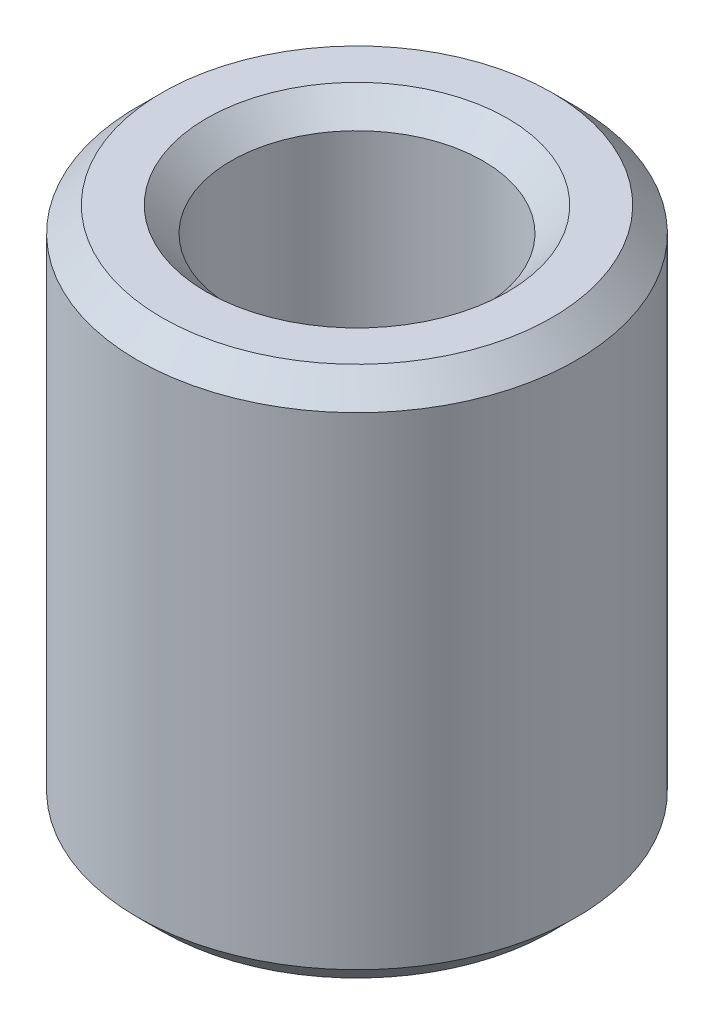
from build123d import *

# Parameters (mm, degrees)
SKETCH1_R           = 20
BOSS_EXTRUDE1_DEPTH = 48.429823894
SKETCH2_R           = 11.471340663
CUT_EXTRUDE1_DEPTH  = 57.084292297
CHAMFER1_SIZE       = 2.237364144


with BuildPart() as part:
    # Sketch1 → Boss-Extrude1 (new body)
    with BuildSketch(Plane(origin=(0, 0, 0), x_dir=(1, 0, 0), z_dir=(0, 1, 0))):
        Circle(SKETCH1_R)
    extrude(amount=BOSS_EXTRUDE1_DEPTH)

    # Sketch2 → Cut-Extrude1 (cut, through all)
    with BuildSketch(Plane(origin=(0, 0, 0), x_dir=(1, 0, 0), z_dir=(0, 1, 0))):
        Circle(SKETCH2_R)
    extrude(amount=CUT_EXTRUDE1_DEPTH, mode=Mode.SUBTRACT)

    # Chamfer1
    chamfer1_edges = [part.edges().sort_by_distance(p)[0] for p in [
        (-11.471340663, 48.429823894, 0),
        (-11.471340663, 0, 0),
        (-20, 0, 0),
        (-20, 48.429823894, 0),
    ]]
    chamfer(chamfer1_edges, length=CHAMFER1_SIZE)


solid = part.part
